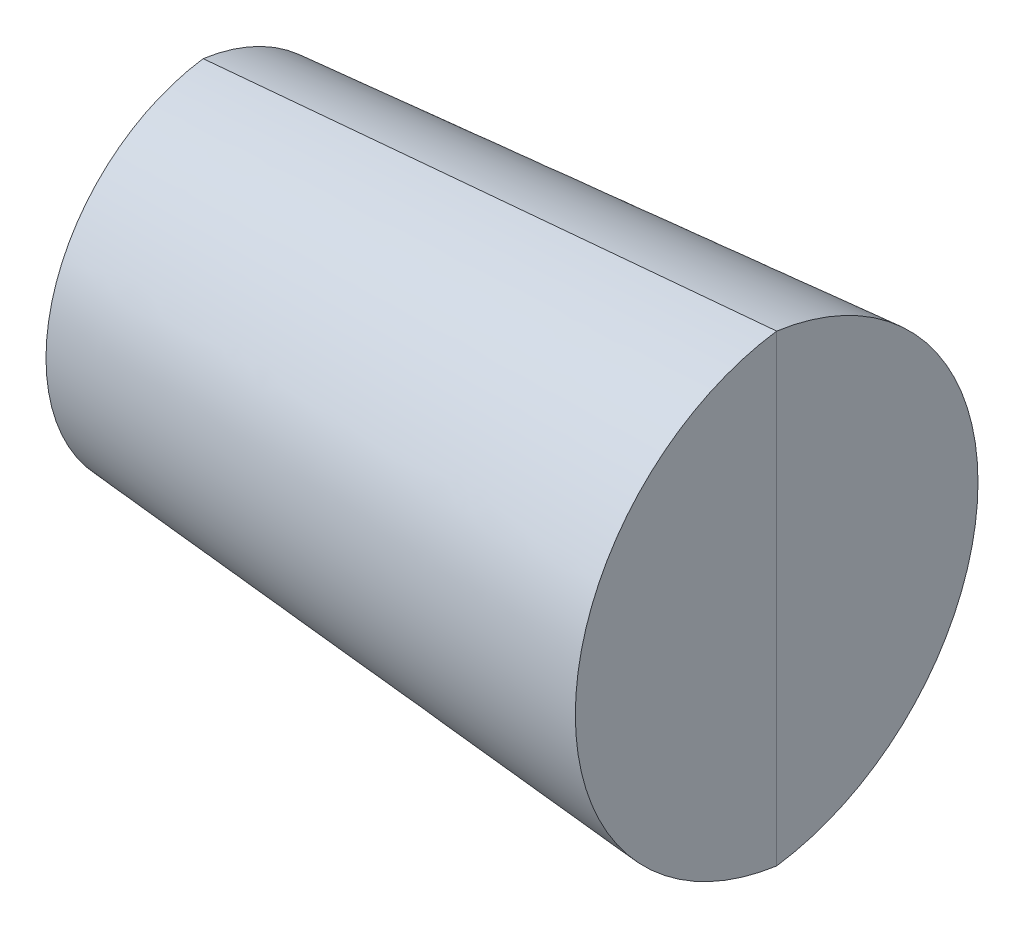
from build123d import *


with BuildPart() as part:
    # Sketch2 for Loft1 → Loft1 section 0
    with BuildSketch(Plane(origin=(158.61, 0, 0), x_dir=(0, 0, -1), z_dir=(1, 0, 0))):
        with BuildLine():
            Line((0, -64.055), (0, 64.055))
            # circular arc as an exact rational Bezier (weights 1, cos(half-angle), 1)
            Bezier((0, 64.055), (-455.775007567, 0), (0, -64.055), weights=[1, 0.139173101, 1])
        make_face()
    # Sketch1 for Loft1 → Loft1 section 1
    with BuildSketch(Plane(origin=(0, 0, 0), x_dir=(0, 0, -1), z_dir=(1, 0, 0))):
        with BuildLine():
            Line((0, -50), (0, 50))
            Bezier((0, 50), (-355.768486119, 0), (0, -50), weights=[1, 0.139173101, 1])
        make_face()
    loft()


with BuildPart() as body_2:
    # Mirror3: mirrored copy
    add(part.part.mirror(Plane(origin=(0, 0, 0), x_dir=(1, 0, 0), z_dir=(0, 0, -1))))


solid = Compound([part.part, body_2.part])
